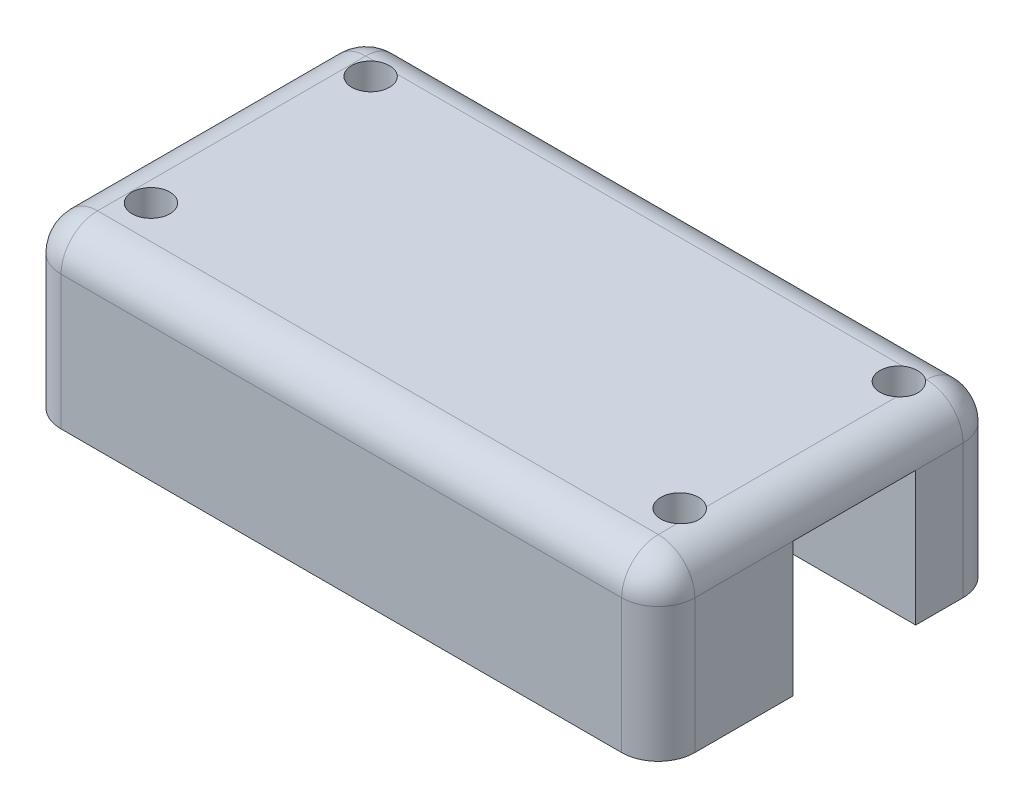
from build123d import *

# Parameters (mm, degrees)
CROQUIS1_W              = 52
CROQUIS1_H              = 28
CROQUIS1_R              = 1.55
SALIENTE_EXTRUIR1_DEPTH = 14
CROQUIS2_W              = 62.635554568
CROQUIS2_H              = 10.05
CORTAR_EXTRUIR1_DEPTH   = 11
REDONDEO2_START         = -14
REDONDEO2_DEPTH         = 28
REDONDEO2_START_2       = -27
REDONDEO2_2_DEPTH       = 54
REDONDEO3_R             = 3


with BuildPart() as part:
    # Croquis1 → Saliente-Extruir1 (new body)
    with BuildSketch(Plane(origin=(0, 0, 0), x_dir=(1, 0, 0), z_dir=(0, 1, 0))):
        Rectangle(CROQUIS1_W, CROQUIS1_H)
        with Locations(Location((-21.372490304, -8.249987757, 0), (0, 0, 270))):
            Circle(CROQUIS1_R, mode=Mode.SUBTRACT)
        with Locations(Location((22.010248646, -8.249987757, 0), (0, 0, 270))):
            Circle(CROQUIS1_R, mode=Mode.SUBTRACT)
        with Locations(Location((-21.351495904, 9.75, 0), (0, 0, 270))):
            Circle(CROQUIS1_R, mode=Mode.SUBTRACT)
        with Locations(Location((21.989254247, 9.75, 0), (0, 0, 270))):
            Circle(CROQUIS1_R, mode=Mode.SUBTRACT)
    extrude(amount=SALIENTE_EXTRUIR1_DEPTH)

    # Croquis2 → Cortar-Extruir1 (cut)
    with BuildSketch(Plane.XZ):
        with Locations((0, -2.1)):
            Rectangle(CROQUIS2_W, CROQUIS2_H)
    extrude(amount=-CORTAR_EXTRUIR1_DEPTH, mode=Mode.SUBTRACT)

    # Redondeo2: read off the stored shape, not the designer's step
    # Redondeo2 outline → Redondeo2 (cut)
    with BuildSketch(Plane.XY.offset(REDONDEO2_START)):
        with BuildLine():
            ThreePointArc((-26, 11), (-25.121320344, 13.121320344), (-23, 14))
            Line((-23, 14), (-26, 14))
            Line((-26, 14), (-26, 11))
        make_face()
        with BuildLine():
            ThreePointArc((23, 14), (25.121320344, 13.121320344), (26, 11))
            Line((26, 11), (26, 14))
            Line((26, 14), (23, 14))
        make_face()
    extrude(amount=REDONDEO2_DEPTH, mode=Mode.SUBTRACT)

    # Redondeo2 2 outline → Redondeo2 2 (cut)
    with BuildSketch(Plane.YZ.offset(REDONDEO2_START_2)):
        with BuildLine():
            ThreePointArc((11, 14), (13.121320344, 13.121320344), (14, 11))
            Line((14, 11), (14, 14))
            Line((14, 14), (11, 14))
        make_face()
        with BuildLine():
            ThreePointArc((14, -11), (13.121320344, -13.121320344), (11, -14))
            Line((11, -14), (14, -14))
            Line((14, -14), (14, -11))
        make_face()
    extrude(amount=REDONDEO2_2_DEPTH, mode=Mode.SUBTRACT)

    # Redondeo3
    # the kernel refuses this fillet: 3 mm, written as the material it takes off along each edge
    with BuildSketch(Plane(origin=(23, 11, -11), x_dir=(1, 0, 0), z_dir=(0, 0, -1))) as redondeo3_piece_1_section:
        Polygon((0, 0), (REDONDEO3_R, 0), (REDONDEO3_R, -REDONDEO3_R), (0, -REDONDEO3_R), align=None)
    redondeo3_piece_1 = extrude(amount=REDONDEO3_R, mode=Mode.PRIVATE)
    redondeo3_piece_1 = redondeo3_piece_1 - Plane(origin=(23, 11, -11), x_dir=(-0.7071067811865475, -0.7071067811865475, 0), z_dir=(0, 0, -1)) * Sphere(REDONDEO3_R, mode=Mode.PRIVATE)
    add(redondeo3_piece_1, mode=Mode.SUBTRACT)
    with BuildSketch(Plane(origin=(23, 11, 11), x_dir=(0, 0, 1), z_dir=(1, 0, 0))) as redondeo3_piece_2_section:
        Polygon((0, 0), (REDONDEO3_R, 0), (REDONDEO3_R, -REDONDEO3_R), (0, -REDONDEO3_R), align=None)
    redondeo3_piece_2 = extrude(amount=REDONDEO3_R, mode=Mode.PRIVATE)
    redondeo3_piece_2 = redondeo3_piece_2 - Plane(origin=(23, 11, 11), x_dir=(0, -0.7071067811865475, -0.7071067811865475), z_dir=(1, 0, 0)) * Sphere(REDONDEO3_R, mode=Mode.PRIVATE)
    add(redondeo3_piece_2, mode=Mode.SUBTRACT)
    with BuildSketch(Plane(origin=(-23, 11, -11), x_dir=(-1, 0, 0), z_dir=(0, 0, -1))) as redondeo3_piece_3_section:
        Polygon((0, 0), (REDONDEO3_R, 0), (REDONDEO3_R, REDONDEO3_R), (0, REDONDEO3_R), align=None)
    redondeo3_piece_3 = extrude(amount=REDONDEO3_R, mode=Mode.PRIVATE)
    redondeo3_piece_3 = redondeo3_piece_3 - Plane(origin=(-23, 11, -11), x_dir=(0.7071067811865475, -0.7071067811865475, 0), z_dir=(0, 0, -1)) * Sphere(REDONDEO3_R, mode=Mode.PRIVATE)
    add(redondeo3_piece_3, mode=Mode.SUBTRACT)
    with BuildSketch(Plane(origin=(-23, 11, 11), x_dir=(0, 0, 1), z_dir=(-1, 0, 0))) as redondeo3_piece_4_section:
        Polygon((0, 0), (REDONDEO3_R, 0), (REDONDEO3_R, REDONDEO3_R), (0, REDONDEO3_R), align=None)
    redondeo3_piece_4 = extrude(amount=REDONDEO3_R, mode=Mode.PRIVATE)
    redondeo3_piece_4 = redondeo3_piece_4 - Plane(origin=(-23, 11, 11), x_dir=(0, -0.7071067811865475, -0.7071067811865475), z_dir=(-1, 0, 0)) * Sphere(REDONDEO3_R, mode=Mode.PRIVATE)
    add(redondeo3_piece_4, mode=Mode.SUBTRACT)
    with BuildSketch(Plane(origin=(-26, -7.5, 14), x_dir=(0, 0, -1), z_dir=(0, 1, 0)), Plane(origin=(-26, -7.5, -14), x_dir=(1, 0, 0), z_dir=(0, 1, 0))) as redondeo3_piece_5:
        with BuildLine():
            CenterArc((REDONDEO3_R, -REDONDEO3_R), REDONDEO3_R, 90, 90)
            Line((0, -REDONDEO3_R), (0, 0))
            Line((0, 0), (REDONDEO3_R, 0))
        make_face()
    extrude(amount=18.5, mode=Mode.SUBTRACT)
    with BuildSketch(Plane(origin=(26, -7.5, -14), x_dir=(-1, 0, 0), z_dir=(0, 1, 0)), Plane(origin=(26, -7.5, 14), x_dir=(0, 0, -1), z_dir=(0, 1, 0))) as redondeo3_piece_6:
        with BuildLine():
            CenterArc((REDONDEO3_R, REDONDEO3_R), REDONDEO3_R, 180, 90)
            Line((0, REDONDEO3_R), (0, 0))
            Line((0, 0), (REDONDEO3_R, 0))
        make_face()
    extrude(amount=18.5, mode=Mode.SUBTRACT)


solid = part.part
